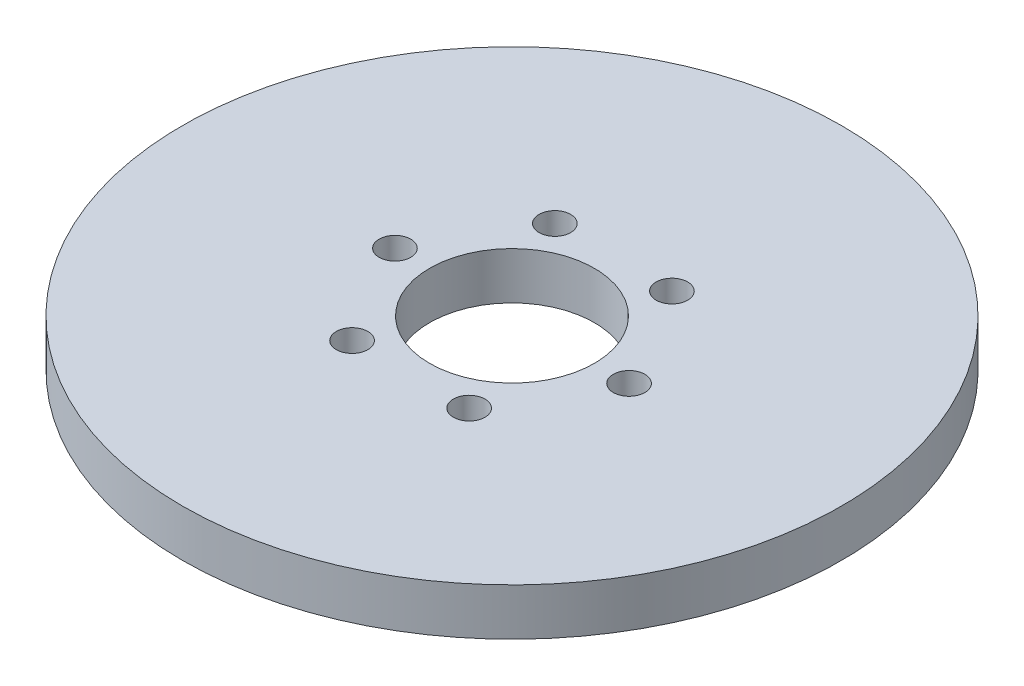
from build123d import *

# Parameters (mm, degrees)
SKETCH1_R           = 70
BOSS_EXTRUDE1_DEPTH = 10
SKETCH2_R           = 17.5
CUT_EXTRUDE1_DEPTH  = 100.498743711
SKETCH3_R           = 3.356735111
CUT_EXTRUDE2_DEPTH  = 9.177195483
CIRPATTERN1_COUNT   = 6


with BuildPart() as part:
    # Sketch1 → Boss-Extrude1 (new body)
    with BuildSketch(Plane(origin=(0, 0, 0), x_dir=(1, 0, 0), z_dir=(0, 1, 0))):
        Circle(SKETCH1_R)
    extrude(amount=BOSS_EXTRUDE1_DEPTH)

    # Sketch2 → Cut-Extrude1 (cut, through all)
    with BuildSketch(Plane(origin=(0, 0, 0), x_dir=(1, 0, 0), z_dir=(0, 1, 0))):
        Circle(SKETCH2_R)
    extrude(amount=CUT_EXTRUDE1_DEPTH, mode=Mode.SUBTRACT)

    # Sketch3 → Cut-Extrude2 (cut)
    with BuildSketch(Plane(origin=(0, 10, 0), x_dir=(1, 0, 0), z_dir=(0, 1, 0))):
        with Locations((-24.866321664, 0)):
            Circle(SKETCH3_R)
    cut_extrude2 = extrude(amount=-CUT_EXTRUDE2_DEPTH, mode=Mode.SUBTRACT)

    # CirPattern1: Cut-Extrude2 ×6 about axis
    cirpattern1_axis = Axis((0, 0, 0), (0, 1, 0))
    for i in range(1, CIRPATTERN1_COUNT):
        add(cut_extrude2.rotate(cirpattern1_axis, i * 360 / CIRPATTERN1_COUNT), mode=Mode.SUBTRACT)


solid = part.part
